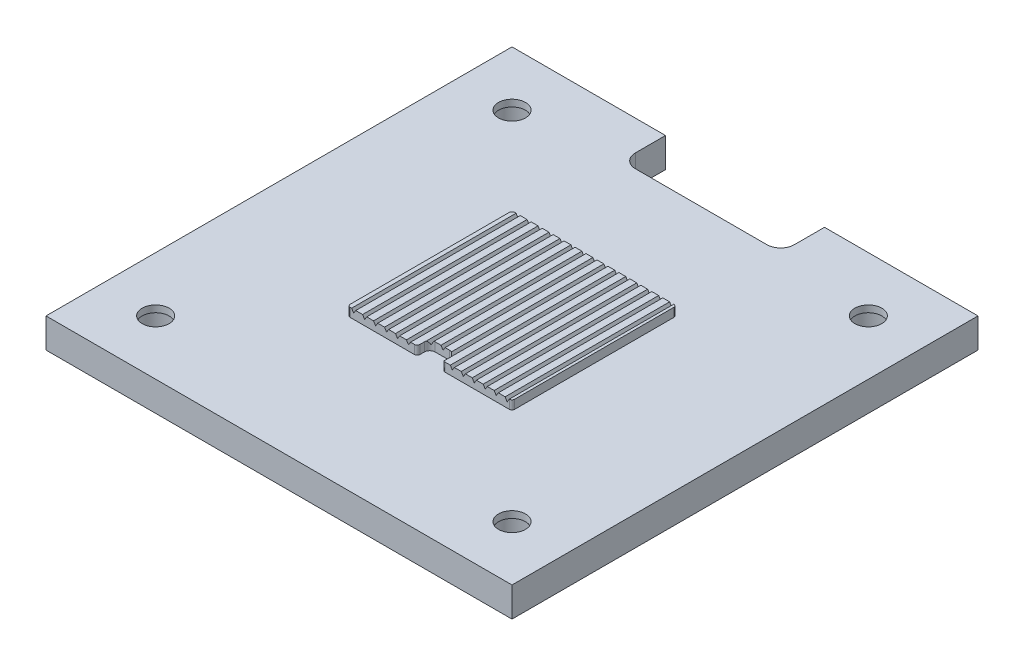
from build123d import *

# Parameters (mm, degrees)
SKETCH1_W           = 85
SKETCH1_H           = 85
SKETCH1_R           = 2.4575
BOSS_EXTRUDE1_DEPTH = 5.4
SKETCH2_R           = 3.969
CUT_EXTRUDE1_DEPTH  = 4.166
SKETCH5_W           = 29
SKETCH5_H           = 8
CUT_EXTRUDE2_DEPTH  = 10
FILLET1_R           = 2.5
BOSS_EXTRUDE3_DEPTH = 1.6
CUT_EXTRUDE5_DEPTH  = 30


with BuildPart() as part:
    # Sketch1 → Boss-Extrude1 (new body)
    with BuildSketch(Plane(origin=(0, 0, 0), x_dir=(1, 0, 0), z_dir=(0, 1, 0))):
        Rectangle(SKETCH1_W, SKETCH1_H)
        with Locations((-32.5, 32.5)):
            Circle(SKETCH1_R, mode=Mode.SUBTRACT)
        with Locations((-32.5, -32.5)):
            Circle(SKETCH1_R, mode=Mode.SUBTRACT)
        with Locations((32.5, -32.5)):
            Circle(SKETCH1_R, mode=Mode.SUBTRACT)
        with Locations((32.5, 32.5)):
            Circle(SKETCH1_R, mode=Mode.SUBTRACT)
    extrude(amount=BOSS_EXTRUDE1_DEPTH)

    # Sketch2 → Cut-Extrude1 (cut)
    with BuildSketch(Plane.XZ):
        with Locations((-32.5, 32.5)):
            Circle(SKETCH2_R)
        with Locations((32.5, 32.5)):
            Circle(SKETCH2_R)
        with Locations((32.5, -32.5)):
            Circle(SKETCH2_R)
        with Locations((-32.5, -32.5)):
            Circle(SKETCH2_R)
    extrude(amount=-CUT_EXTRUDE1_DEPTH, mode=Mode.SUBTRACT)

    # Sketch5 → Cut-Extrude2 (cut)
    with BuildSketch(Plane(origin=(0, 5.4, 0), x_dir=(1, 0, 0), z_dir=(0, 1, 0))):
        with Locations((0, 38.5)):
            Rectangle(SKETCH5_W, SKETCH5_H)
    extrude(amount=-CUT_EXTRUDE2_DEPTH, mode=Mode.SUBTRACT)

    # Fillet1
    fillet1_edges = [part.edges().sort_by_distance(p)[0] for p in [
        (-14.5, 2.7, -34.5),
        (14.5, 2.7, -34.5),
    ]]
    fillet(fillet1_edges, radius=FILLET1_R)

    # Sketch4 → Boss-Extrude3 (add)
    with BuildSketch(Plane(origin=(0, 5.4, 0), x_dir=(1, 0, 0), z_dir=(0, 1, 0))):
        with BuildLine():
            Line((2.2929, -14.5), (2.2929, -13.7071))
            ThreePointArc((2.2929, -13.7071), (2.000006781, -12.999993219), (1.2929, -12.7071))
            Line((1.2929, -12.7071), (-1.2929, -12.7071))
            ThreePointArc((-1.2929, -12.7071), (-2.000006781, -12.999993219), (-2.2929, -13.7071))
            Line((-2.2929, -13.7071), (-2.2929, -14.5))
            ThreePointArc((-2.2929, -14.5), (-2.439346609, -14.853553391), (-2.7929, -15))
            Line((-2.7929, -15), (-14.5, -15))
            ThreePointArc((-14.5, -15), (-14.853553391, -14.853553391), (-15, -14.5))
            Line((-15, -14.5), (-15, 14.5))
            ThreePointArc((-15, 14.5), (-14.853553391, 14.853553391), (-14.5, 15))
            Line((-14.5, 15), (14.5, 15))
            ThreePointArc((14.5, 15), (14.853553391, 14.853553391), (15, 14.5))
            Line((15, 14.5), (15, -14.5))
            ThreePointArc((15, -14.5), (14.853553391, -14.853553391), (14.5, -15))
            Line((14.5, -15), (2.7929, -15))
            ThreePointArc((2.7929, -15), (2.439346609, -14.853553391), (2.2929, -14.5))
        make_face()
    extrude(amount=BOSS_EXTRUDE3_DEPTH)

    # Sketch10 → Cut-Extrude5 (cut)
    with BuildSketch(Plane(origin=(0, 0, -15), x_dir=(-1, 0, 0), z_dir=(0, 0, -1))):
        Polygon((-14.5, 7), (-14.125, 6.38), (-13.75, 7), align=None)
        Polygon((-12.125, 6.38), (-11.75, 7), (-12.5, 7), align=None)
        Polygon((-10.125, 6.38), (-9.75, 7), (-10.5, 7), align=None)
        Polygon((-8.125, 6.38), (-7.75, 7), (-8.5, 7), align=None)
        Polygon((-6.125, 6.38), (-5.75, 7), (-6.5, 7), align=None)
        Polygon((-4.125, 6.38), (-3.75, 7), (-4.5, 7), align=None)
        Polygon((-2.125, 6.38), (-1.75, 7), (-2.5, 7), align=None)
        Polygon((-0.125, 6.38), (0.25, 7), (-0.5, 7), align=None)
        Polygon((1.875, 6.38), (2.25, 7), (1.5, 7), align=None)
        Polygon((3.875, 6.38), (4.25, 7), (3.5, 7), align=None)
        Polygon((5.875, 6.38), (6.25, 7), (5.5, 7), align=None)
        Polygon((7.875, 6.38), (8.25, 7), (7.5, 7), align=None)
        Polygon((9.875, 6.38), (10.25, 7), (9.5, 7), align=None)
        Polygon((11.875, 6.38), (12.25, 7), (11.5, 7), align=None)
        Polygon((13.875, 6.38), (14.25, 7), (13.5, 7), align=None)
    extrude(amount=-CUT_EXTRUDE5_DEPTH, mode=Mode.SUBTRACT)


solid = part.part
